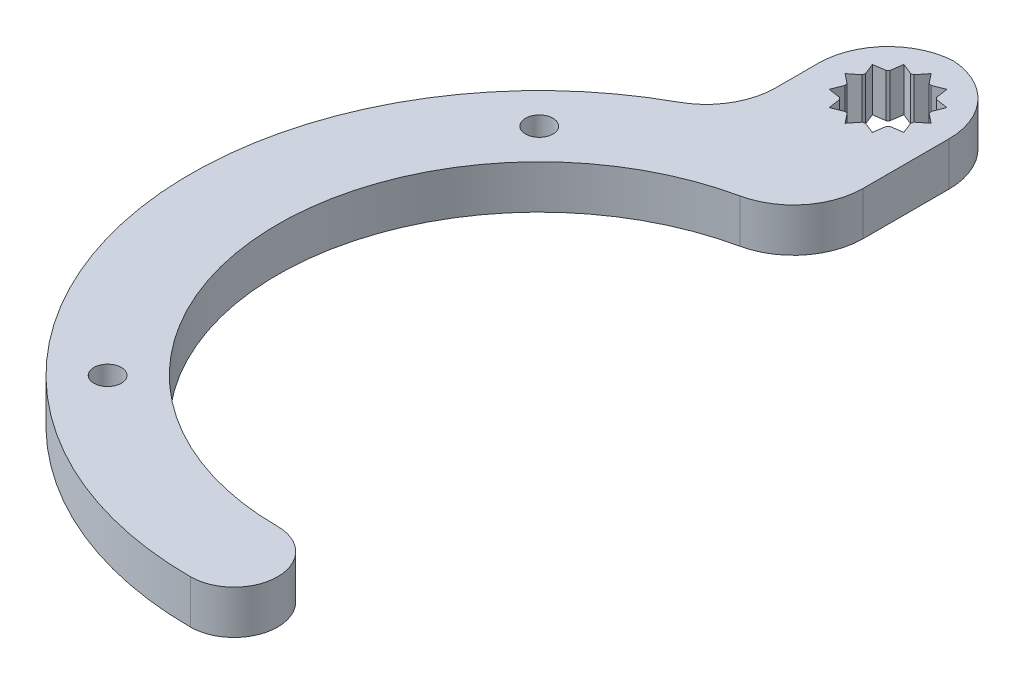
from build123d import *

# Parameters (mm, degrees)
SKETCH1_R           = 3
SKETCH1_R_2         = 2
BOSS_EXTRUDE1_DEPTH = 6.35
FILLET1_R           = 10.16
CUT_EXTRUDE1_DEPTH  = 125.919203888


with BuildPart() as part:
    # Sketch1 → Boss-Extrude1 (new body)
    with BuildSketch(Plane(origin=(0, 0, 0), x_dir=(1, 0, 0), z_dir=(0, 1, 0))):
        with BuildLine():
            Line((19.05, 0), (0, 0))
            Line((0, 0), (0, -22.757139607))
            ThreePointArc((0, -22.757139607), (-30.814603217, -79.553676933), (19.05, -120.65))
            ThreePointArc((19.05, -120.65), (25.4, -114.3), (19.05, -107.95))
            ThreePointArc((19.05, -107.95), (-19.05, -69.85), (19.05, -31.75))
            Line((19.05, -31.75), (19.05, 0))
        make_face()
        with Locations(Location((9.525, -9.525, 0), (0, 0, 270))):
            Circle(SKETCH1_R, mode=Mode.SUBTRACT)
        with Locations(Location((-12.380896424, -38.419103576, 0), (0, 0, 270))):
            Circle(SKETCH1_R_2, mode=Mode.SUBTRACT)
        with Locations(Location((-12.380896424, -101.280896424, 0), (0, 0, 270))):
            Circle(SKETCH1_R_2, mode=Mode.SUBTRACT)
    extrude(amount=BOSS_EXTRUDE1_DEPTH)

    # Fillet1
    # the kernel refuses this fillet: 10.16 mm, written as the material it adds along each edge
    with BuildSketch(Plane(origin=(0, 0, 22.757139607), x_dir=(0, 0, -1), z_dir=(0, 1, 0))) as fillet1_piece_1:
        with BuildLine():
            CenterArc((6.413190667, 10.16), FILLET1_R, 208.630989837, 61.369010163)
            ThreePointArc((-2.50448451, 5.291666667), (-1.175949507, 2.681941807), (0, 0))
            Line((0, 0), (6.413190667, 0))
        make_face()
    extrude(amount=6.35)
    # the kernel refuses this fillet: 10.16 mm, written as the material it takes off along each edge
    with BuildSketch(Plane(origin=(19.05, -22.696015193, 31.75), x_dir=(0, 0, -1), z_dir=(0, 1, 0))) as fillet1_2_piece_1:
        with BuildLine():
            CenterArc((9.078406077, 10.16), FILLET1_R, 192.153197469, 77.846802531)
            ThreePointArc((-0.853889939, 8.021052632), (-0.214073897, 4.033187739), (0, 0))
            Line((0, 0), (9.078406077, 0))
        make_face()
    extrude(amount=51.742030387, mode=Mode.SUBTRACT)
    with BuildSketch(Plane(origin=(0, -25.4, 0), x_dir=(1, 0, 0), z_dir=(0, 1, 0)), Plane(origin=(19.05, -25.4, 0), x_dir=(0, 0, 1), z_dir=(0, 1, 0))) as fillet1_2_piece_2:
        with BuildLine():
            CenterArc((FILLET1_R, -FILLET1_R), FILLET1_R, 90, 90)
            Line((0, -FILLET1_R), (0, 0))
            Line((0, 0), (FILLET1_R, 0))
        make_face()
    extrude(amount=57.15, mode=Mode.SUBTRACT)

    # Sketch2 → Cut-Extrude1 (cut, through all)
    with BuildSketch(Plane(origin=(0, 6.35, 0), x_dir=(1, 0, 0), z_dir=(0, 1, 0))):
        with BuildLine():
            Line((9.525, -3.255), (10.629314157, -4.648475598))
            ThreePointArc((10.629314157, -4.648475598), (10.819095226, -4.695370869), (11.006898087, -4.749648907))
            Line((11.006898087, -4.749648907), (12.66, -4.095020718))
            Line((12.66, -4.095020718), (12.919626315, -5.853963064))
            ThreePointArc((12.919626315, -5.853963064), (13.060533906, -5.989466094), (13.196036936, -6.130373685))
            Line((13.196036936, -6.130373685), (14.954979282, -6.39))
            Line((14.954979282, -6.39), (14.300351093, -8.043101913))
            ThreePointArc((14.300351093, -8.043101913), (14.354629131, -8.230904774), (14.401524402, -8.420685843))
            Line((14.401524402, -8.420685843), (15.795, -9.525))
            Line((15.795, -9.525), (14.401524402, -10.629314157))
            ThreePointArc((14.401524402, -10.629314157), (14.354629131, -10.819095226), (14.300351093, -11.006898087))
            Line((14.300351093, -11.006898087), (14.954979282, -12.66))
            Line((14.954979282, -12.66), (13.196036936, -12.919626315))
            ThreePointArc((13.196036936, -12.919626315), (13.060533906, -13.060533906), (12.919626315, -13.196036936))
            Line((12.919626315, -13.196036936), (12.66, -14.954979282))
            Line((12.66, -14.954979282), (11.006898087, -14.300351093))
            ThreePointArc((11.006898087, -14.300351093), (10.819095226, -14.354629131), (10.629314157, -14.401524402))
            Line((10.629314157, -14.401524402), (9.525, -15.795))
            Line((9.525, -15.795), (8.420685843, -14.401524402))
            ThreePointArc((8.420685843, -14.401524402), (8.230904774, -14.354629131), (8.043101913, -14.300351093))
            Line((8.043101913, -14.300351093), (6.39, -14.954979282))
            Line((6.39, -14.954979282), (6.130373685, -13.196036936))
            ThreePointArc((6.130373685, -13.196036936), (5.989466094, -13.060533906), (5.853963064, -12.919626315))
            Line((5.853963064, -12.919626315), (4.095020718, -12.66))
            Line((4.095020718, -12.66), (4.749648907, -11.006898087))
            ThreePointArc((4.749648907, -11.006898087), (4.695370869, -10.819095226), (4.648475598, -10.629314157))
            Line((4.648475598, -10.629314157), (3.255, -9.525))
            Line((3.255, -9.525), (4.648475598, -8.420685843))
            ThreePointArc((4.648475598, -8.420685843), (4.695370869, -8.230904774), (4.749648907, -8.043101913))
            Line((4.749648907, -8.043101913), (4.095020718, -6.39))
            Line((4.095020718, -6.39), (5.853963064, -6.130373685))
            ThreePointArc((5.853963064, -6.130373685), (5.989466094, -5.989466094), (6.130373685, -5.853963064))
            Line((6.130373685, -5.853963064), (6.39, -4.095020718))
            Line((6.39, -4.095020718), (8.043101913, -4.749648907))
            ThreePointArc((8.043101913, -4.749648907), (8.230904774, -4.695370869), (8.420685843, -4.648475598))
            Line((8.420685843, -4.648475598), (9.525, -3.255))
        make_face()
    extrude(amount=-CUT_EXTRUDE1_DEPTH, mode=Mode.SUBTRACT)


solid = part.part
